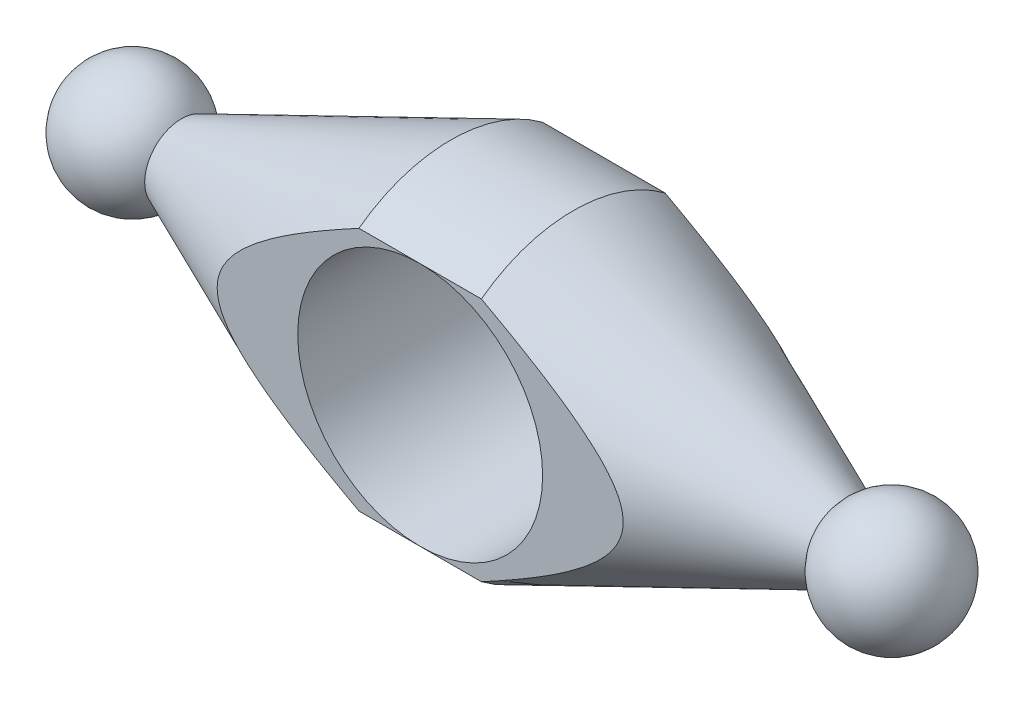
from build123d import *


with BuildPart() as part:
    # Эскиз1 → Повернуть1 (revolve)
    with BuildSketch(Plane.XY):
        with BuildLine():
            Line((9, 3), (31, 12.5))
            Line((31, 12.5), (41, 12.5))
            Line((41, 12.5), (63, 3))
            ThreePointArc((63, 3), (68.58113883, 4.74341649), (72, 0))
            Line((72, 0), (0, 0))
            ThreePointArc((0, 0), (3.41886117, 4.74341649), (9, 3))
        make_face()
    revolve(axis=Axis((0, 0, 0), (1, 0, 0)))

    # Эскиз4 → Вырез-Повернуть1 (revolve, cut)
    with BuildSketch(Plane(origin=(36, 0, 0), x_dir=(0, 0, -1), z_dir=(1, 0, 0))):
        Polygon((-7.5, 10), (7.5, 10), (7.5, 20), (15, 20), (15, 0), (-15, 0), (-15, 20), (-7.5, 20), align=None)
    revolve(axis=Axis((36, 0, 0), (0, 0, -1)), mode=Mode.SUBTRACT)


solid = part.part
